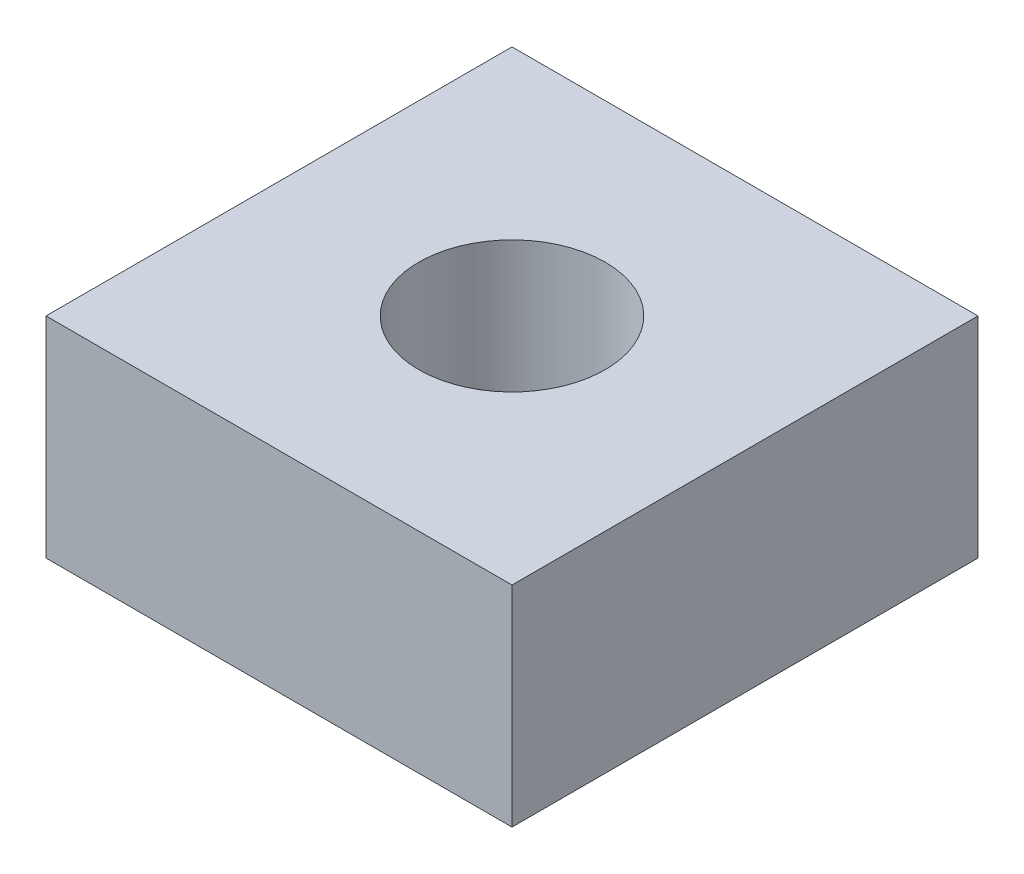
from build123d import *

# Parameters (mm, degrees)
SKETCH1_W           = 10
SKETCH1_H           = 10
SKETCH1_R           = 2
BOSS_EXTRUDE1_DEPTH = 4.5


with BuildPart() as part:
    # Sketch1 → Boss-Extrude1 (new body)
    with BuildSketch(Plane(origin=(0, 0, 0), x_dir=(1, 0, 0), z_dir=(0, 1, 0))):
        Rectangle(SKETCH1_W, SKETCH1_H)
        Circle(SKETCH1_R, mode=Mode.SUBTRACT)
    extrude(amount=BOSS_EXTRUDE1_DEPTH)


solid = part.part
